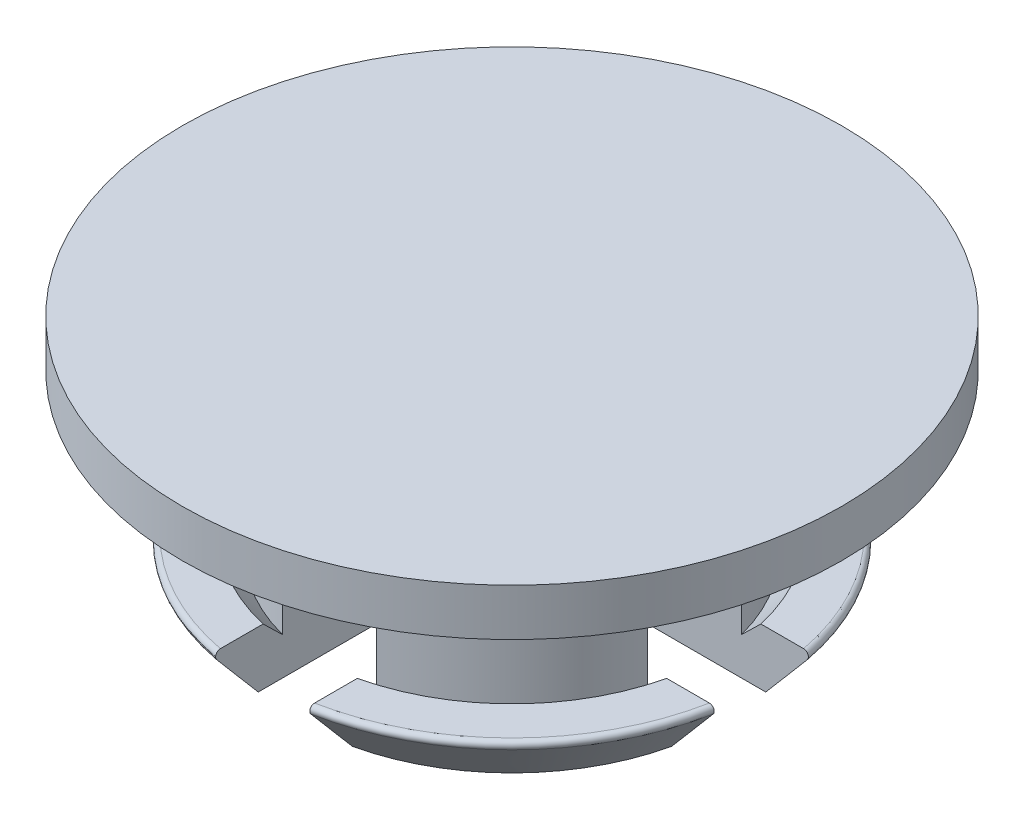
from build123d import *

# Parameters (mm, degrees)
SZKIC1_R                    = 7
DODANIE_WYCI_GNI_CIE1_DEPTH = 1
SZKIC2_R                    = 4
DODANIE_WYCI_GNI_CIE2_DEPTH = 4.22
ZAOKR_GLENIE1_R             = 0.1
WYTNIJ_WYCI_GNI_CIE1_DEPTH  = 4.22


with BuildPart() as part:
    # Szkic1 → Dodanie-wyciągnięcie1 (new body)
    with BuildSketch(Plane(origin=(0, 0, 0), x_dir=(1, 0, 0), z_dir=(0, 1, 0))):
        Circle(SZKIC1_R)
    extrude(amount=DODANIE_WYCI_GNI_CIE1_DEPTH)

    # Szkic2 → Dodanie-wyciągnięcie2 (add)
    with BuildSketch(Plane(origin=(0, 0, 0), x_dir=(-1, 0, 0), z_dir=(0, -1, 0))):
        Circle(SZKIC2_R)
    extrude(amount=DODANIE_WYCI_GNI_CIE2_DEPTH)

    # Szkic3 → Obrót1 (revolve)
    with BuildSketch(Plane(origin=(0, 0, 0), x_dir=(0, 0, -1), z_dir=(1, 0, 0))):
        Polygon((4, -4.22), (4.5, -4.22), (5.5, -3.02), (4.4, -3.02), (4, -3.42), align=None)
    revolve(axis=Axis((0, -4.22, 0), (0, 1, 0)))

    # Zaokrąglenie1
    zaokr_glenie1_edges = [part.edges().sort_by_distance(p)[0] for p in [
        (0, -3.02, 5.5),
    ]]
    fillet(zaokr_glenie1_edges, radius=ZAOKR_GLENIE1_R)

    # Szkic5 → Wytnij-wyciągnięcie1 (cut)
    with BuildSketch(Plane(origin=(0, -4.22, 0), x_dir=(-1, 0, 0), z_dir=(0, -1, 0))):
        with BuildLine():
            Line((-7.794060286, -1), (-1, -1))
            Line((-1, -1), (-1, -7.794060286))
            ThreePointArc((-1, -7.794060286), (0, -7.857949844), (1, -7.794060286))
            Line((1, -7.794060286), (1, -1))
            Line((1, -1), (7.794060286, -1))
            ThreePointArc((7.794060286, -1), (7.857949844, 0), (7.794060286, 1))
            Line((7.794060286, 1), (1, 1))
            Line((1, 1), (1, 7.794060286))
            ThreePointArc((1, 7.794060286), (0, 7.857949844), (-1, 7.794060286))
            Line((-1, 7.794060286), (-1, 1))
            Line((-1, 1), (-7.794060286, 1))
            ThreePointArc((-7.794060286, 1), (-7.857949844, 0), (-7.794060286, -1))
        make_face()
    extrude(amount=-WYTNIJ_WYCI_GNI_CIE1_DEPTH, mode=Mode.SUBTRACT)


solid = part.part
